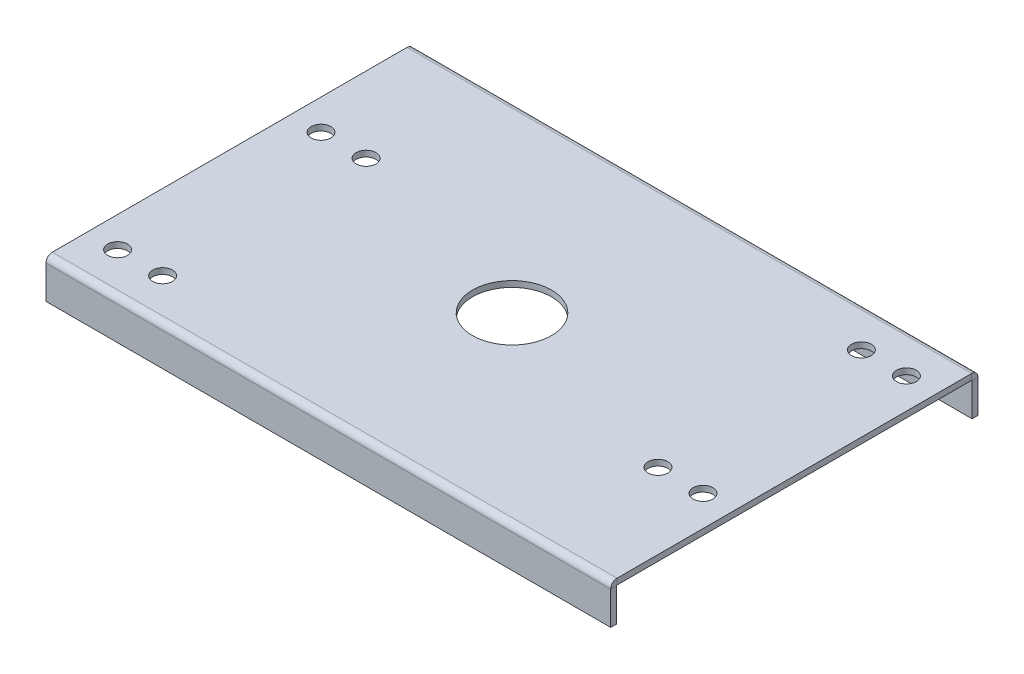
from build123d import *

# Parameters (mm, degrees)
SKETCH2_W                      = 143
SKETCH2_H                      = 93
BASE_FLANGE1_DEPTH             = 1.5
EDGE_FLANGE1_STRIP_W           = 6.2
EDGE_FLANGE1_STRIP_H           = 1.5
EDGE_FLANGE1_STRIP_CUT_DEPTH   = 143
EDGE_FLANGE1_STRIP_2_W         = 6.2
EDGE_FLANGE1_STRIP_2_H         = 1.5
EDGE_FLANGE1_STRIP_CUT_2_DEPTH = 143
EDGE_FLANGE1_DEPTH             = 143
EDGE_FLANGE1_BEND_DEPTH        = 143
SKETCH13_R                     = 10
CUT_EXTRUDE1_DEPTH             = 1.5
SKETCH14_R                     = 2.5
CUT_EXTRUDE2_DEPTH             = 1.5


# Sheet-metal steps are written as plain solids
with BuildPart() as part:
    # Sketch2 → Base-Flange1 (new body)
    with BuildSketch(Plane(origin=(0, 0, 0), x_dir=(1, 0, 0), z_dir=(0, 1, 0))):
        Rectangle(SKETCH2_W, SKETCH2_H)
    extrude(amount=-BASE_FLANGE1_DEPTH)

    # Edge-Flange1 strip (across the edge) → Edge-Flange1 strip cut (cut)
    with BuildSketch(Plane(origin=(71.5, -1.5, 46.5), x_dir=(0, 0, -1), z_dir=(-1, 0, 0))):
        with Locations((-1.5, -0.75)):
            Rectangle(EDGE_FLANGE1_STRIP_W, EDGE_FLANGE1_STRIP_H)
    extrude(amount=EDGE_FLANGE1_STRIP_CUT_DEPTH, mode=Mode.SUBTRACT)

    # Edge-Flange1 strip 2 (across the edge) → Edge-Flange1 strip cut 2 (cut)
    with BuildSketch(Plane(origin=(-71.5, -1.5, -46.5), x_dir=(0, 0, 1), z_dir=(1, 0, 0))):
        with Locations((-1.5, -0.75)):
            Rectangle(EDGE_FLANGE1_STRIP_2_W, EDGE_FLANGE1_STRIP_2_H)
    extrude(amount=EDGE_FLANGE1_STRIP_CUT_2_DEPTH, mode=Mode.SUBTRACT)

    # Edge-Flange1 section (across the edge) → Edge-Flange1 (add)
    with BuildSketch(Plane(origin=(71.5, -1.5, 46.5), x_dir=(0, 0, -1), z_dir=(-1, 0, 0))):
        with BuildLine():
            Line((0, 0.1), (0, 8.5))
            Line((0, 8.5), (1.5, 8.5))
            Line((1.5, 8.5), (1.5, 0.1))
            ThreePointArc((1.5, 0.1), (1.529289322, 0.029289322), (1.6, 0))
            Line((1.6, 0), (1.6, -1.5))
            ThreePointArc((1.6, -1.5), (0.46862915, -1.03137085), (0, 0.1))
        make_face()
    extrude(amount=EDGE_FLANGE1_DEPTH)

    # Edge-Flange1 section 2 (across the edge) → Edge-Flange1 bend (add)
    with BuildSketch(Plane(origin=(-71.5, -1.5, -46.5), x_dir=(0, 0, 1), z_dir=(1, 0, 0))):
        with BuildLine():
            Line((0, 0.1), (0, 8.5))
            Line((0, 8.5), (1.5, 8.5))
            Line((1.5, 8.5), (1.5, 0.1))
            ThreePointArc((1.5, 0.1), (1.529289322, 0.029289322), (1.6, 0))
            Line((1.6, 0), (1.6, -1.5))
            ThreePointArc((1.6, -1.5), (0.46862915, -1.03137085), (0, 0.1))
        make_face()
    extrude(amount=EDGE_FLANGE1_BEND_DEPTH)

    # Sketch13 → Cut-Extrude1 (cut)
    with BuildSketch(Plane(origin=(0, 0, 0), x_dir=(1, 0, 0), z_dir=(0, 1, 0))):
        with Locations(Location((0, 0, 0), (0, 0, 270))):
            Circle(SKETCH13_R)
    extrude(amount=-CUT_EXTRUDE1_DEPTH, mode=Mode.SUBTRACT)

    # Sketch14 → Cut-Extrude2 (cut)
    with BuildSketch(Plane(origin=(0, 0, 0), x_dir=(1, 0, 0), z_dir=(0, 1, 0))):
        with Locations(Location((63.775, 36.1, 0), (0, 0, 270))):
            Circle(SKETCH14_R)
        with Locations(Location((52.365, 36.1, 0), (0, 0, 270))):
            Circle(SKETCH14_R)
        with Locations(Location((52.365, -15.41, 0), (0, 0, 270))):
            Circle(SKETCH14_R)
        with Locations(Location((63.775, -15.41, 0), (0, 0, 270))):
            Circle(SKETCH14_R)
        with Locations(Location((-63.775, -36.1, 0), (0, 0, 270))):
            Circle(SKETCH14_R)
        with Locations(Location((-52.365, -36.1, 0), (0, 0, 270))):
            Circle(SKETCH14_R)
        with Locations(Location((-52.365, 15.41, 0), (0, 0, 270))):
            Circle(SKETCH14_R)
        with Locations(Location((-63.775, 15.41, 0), (0, 0, 270))):
            Circle(SKETCH14_R)
    extrude(amount=-CUT_EXTRUDE2_DEPTH, mode=Mode.SUBTRACT)


solid = part.part
